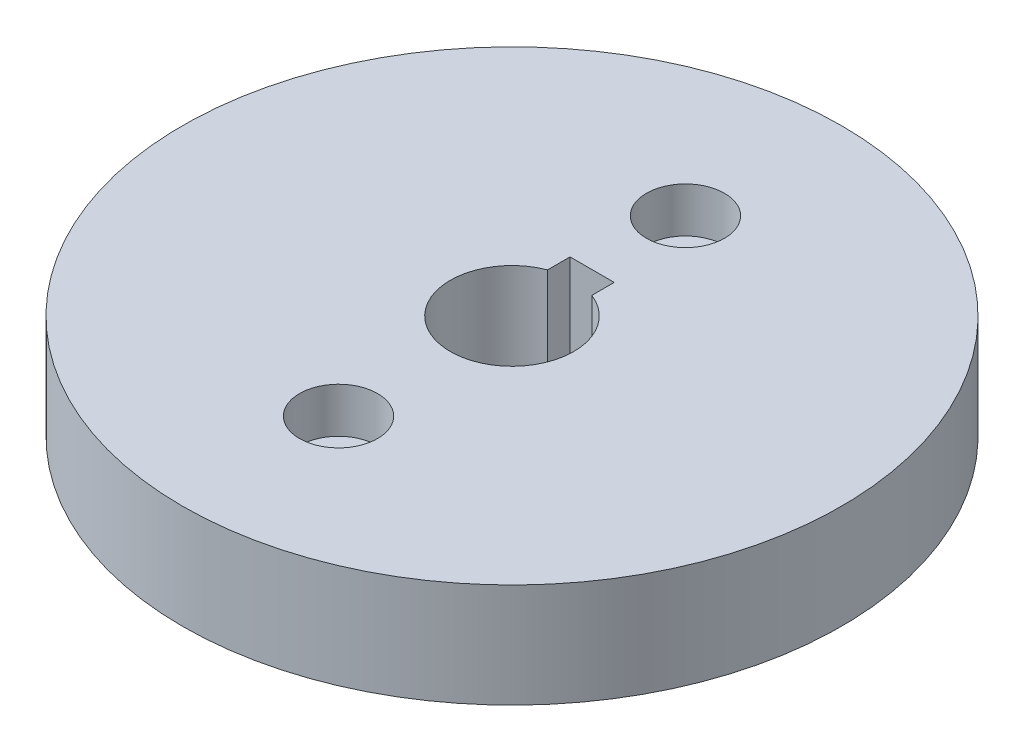
from build123d import *

# Parameters (mm, degrees)
SKETCH1_R           = 38
BOSS_EXTRUDE1_DEPTH = 12
SKETCH2_R           = 2.75
CUT_EXTRUDE1_DEPTH  = 25
SKETCH3_R           = 4.5
CUT_EXTRUDE3_DEPTH  = 5.2
CUT_EXTRUDE4_DEPTH  = 27


with BuildPart() as part:
    # Sketch1 → Boss-Extrude1 (new body)
    with BuildSketch(Plane(origin=(0, 0, 0), x_dir=(1, 0, 0), z_dir=(0, 1, 0))):
        Circle(SKETCH1_R)
    extrude(amount=BOSS_EXTRUDE1_DEPTH)

    # Sketch2 → Cut-Extrude1 (cut)
    with BuildSketch(Plane(origin=(0, 12, 0), x_dir=(1, 0, 0), z_dir=(0, 1, 0))):
        with Locations((0, 20)):
            Circle(SKETCH2_R)
        with Locations((0, -20)):
            Circle(SKETCH2_R)
    extrude(amount=-CUT_EXTRUDE1_DEPTH, mode=Mode.SUBTRACT)

    # Sketch3 → Cut-Extrude3 (cut)
    with BuildSketch(Plane(origin=(0, 12, 0), x_dir=(1, 0, 0), z_dir=(0, 1, 0))):
        with Locations((0, 20)):
            Circle(SKETCH3_R)
        with Locations((0, -20)):
            Circle(SKETCH3_R)
    extrude(amount=-CUT_EXTRUDE3_DEPTH, mode=Mode.SUBTRACT)

    # Sketch4 → Cut-Extrude4 (cut)
    with BuildSketch(Plane(origin=(0, 12, 0), x_dir=(1, 0, 0), z_dir=(0, 1, 0))):
        with BuildLine():
            Line((-2.55, 9.24), (-2.55, 6.64769885))
            ThreePointArc((-2.55, 6.64769885), (0, -7.12), (2.55, 6.64769885))
            Line((2.55, 6.64769885), (2.55, 9.24))
            Line((2.55, 9.24), (-2.55, 9.24))
        make_face()
    extrude(amount=-CUT_EXTRUDE4_DEPTH, mode=Mode.SUBTRACT)


solid = part.part
